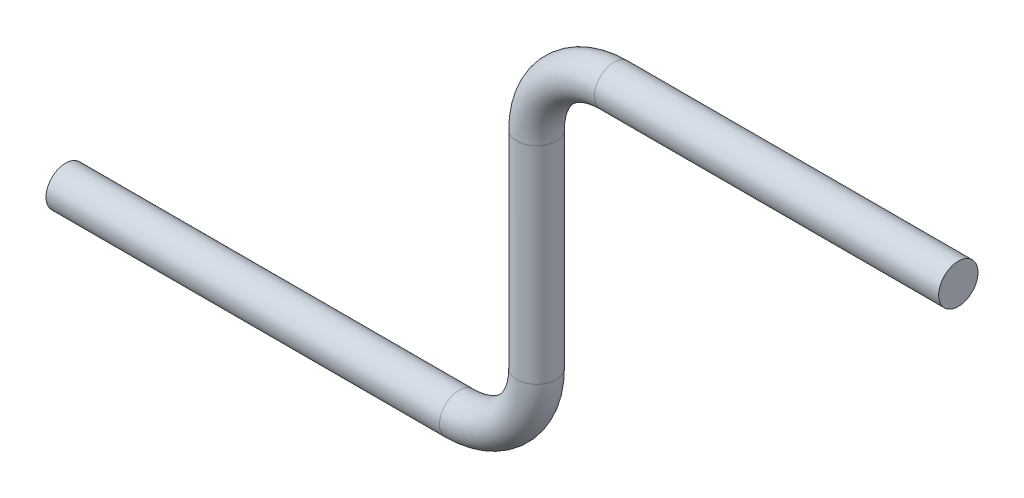
from build123d import *

# Parameters (mm, degrees)
SKETCH3_R = 2


with BuildPart() as part:
    # Sweep1: sweep along a path in Sketch1
    with BuildLine(Plane.XY) as sweep1_path:
        Line((-15.563195439, 0), (24.436804561, 0))
        ThreePointArc((24.436804561, 0), (30.004211849, 2.306095606), (32.310307454, 7.873502893))
        Line((32.310307454, 7.873502893), (32.310307454, 28.873502893))
        ThreePointArc((32.310307454, 28.873502893), (34.61640306, 34.44091018), (40.183810347, 36.747005786))
        Line((40.183810347, 36.747005786), (75.183810347, 36.747005786))
    # Sketch3 → Sweep1 (sweep)
    with BuildSketch(Plane(origin=(-15.563195439, 0, 0), x_dir=(0, 0, -1), z_dir=(1, 0, 0))):
        Circle(SKETCH3_R)
    sweep(path=sweep1_path.line)


solid = part.part
